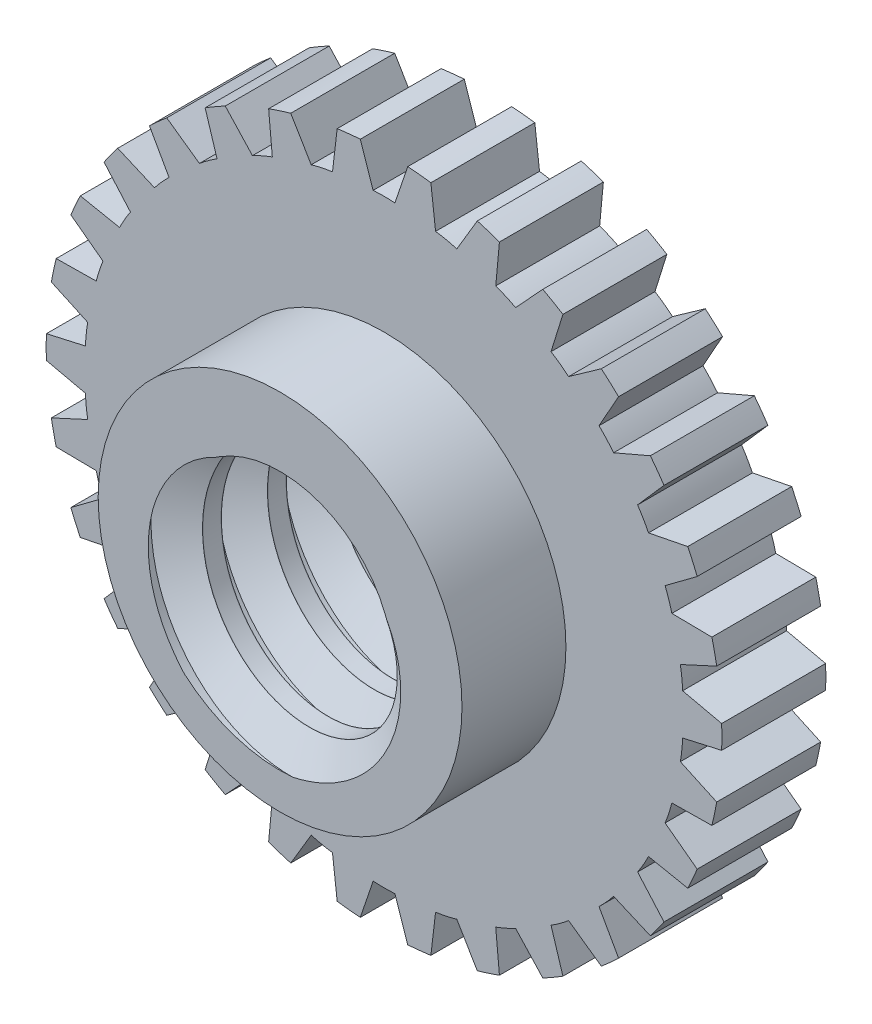
from build123d import *

# Parameters (mm, degrees)
IZIM1_R                     = 13
IZIM1_R_2                   = 4
Y_KSEKLIK_EKSTR_ZYON1_DEPTH = 4
IZIM2_R                     = 7
IZIM2_R_2                   = 4
Y_KSEKLIK_EKSTR_ZYON2_DEPTH = 4
KES_EKSTR_ZYON1_DEPTH       = 4
KES_S_P_R1_PITCH            = 2.5


with BuildPart() as part:
    # Çizim1 → Yükseklik-Ekstrüzyon1 (new body)
    with BuildSketch(Plane.XY):
        Circle(IZIM1_R)
        Circle(IZIM1_R_2, mode=Mode.SUBTRACT)
    extrude(amount=Y_KSEKLIK_EKSTR_ZYON1_DEPTH)

    # Çizim2 → Yükseklik-Ekstrüzyon2 (add)
    with BuildSketch(Plane.XY.offset(4)):
        Circle(IZIM2_R)
        Circle(IZIM2_R_2, mode=Mode.SUBTRACT)
    extrude(amount=Y_KSEKLIK_EKSTR_ZYON2_DEPTH)

    # Çizim3 → Kes-Ekstrüzyon1 (cut)
    with BuildSketch(Plane(origin=(0, 0, 0), x_dir=(-1, 0, 0), z_dir=(0, 0, -1))):
        with BuildLine():
            Line((2.802264463, 11.170557123), (3.589488331, 12.494621784))
            ThreePointArc((3.589488331, 12.494621784), (2.707778009, 12.739093953), (1.802859761, 12.87438141))
            Line((1.802859761, 12.87438141), (1.983478934, 11.34459536))
            ThreePointArc((1.983478934, 11.34459536), (2.395910473, 11.271872552), (2.802264463, 11.170557123))
        make_face()
        with BuildLine():
            Line((0.418538842, 11.509077192), (0.913271457, 12.967880908))
            ThreePointArc((0.913271457, 12.967880908), (0, 13.02369289), (-0.913271457, 12.967880908))
            Line((-0.913271457, 12.967880908), (-0.418538842, 11.509077192))
            ThreePointArc((-0.418538842, 11.509077192), (0, 11.52369289), (0.418538842, 11.509077192))
        make_face()
        with BuildLine():
            Line((5.06351768, 10.343830106), (6.10882734, 11.475287732))
            ThreePointArc((6.10882734, 11.475287732), (5.297213127, 11.897735482), (4.440197357, 12.218209666))
            Line((4.440197357, 12.218209666), (4.298809163, 10.684300274))
            ThreePointArc((4.298809163, 10.684300274), (4.687108162, 10.527417295), (5.06351768, 10.343830106))
        make_face()
        with BuildLine():
            Line((7.103470877, 9.065028079), (8.361181281, 9.954428542))
            ThreePointArc((8.361181281, 9.954428542), (7.655134611, 10.536388878), (6.883477022, 11.02804353))
            Line((6.883477022, 11.02804353), (6.426260804, 9.557049997))
            ThreePointArc((6.426260804, 9.557049997), (6.773456733, 9.322863386), (7.103470877, 9.065028079))
        make_face()
        with BuildLine():
            Line((8.832968311, 7.390040825), (10.248111478, 7.998513057))
            ThreePointArc((10.248111478, 7.998513057), (9.67848998, 8.714551521), (9.02591571, 9.355898973))
            Line((9.02591571, 9.355898973), (8.272854012, 8.012110775))
            ThreePointArc((8.272854012, 8.012110775), (8.563772742, 7.710855611), (8.832968311, 7.390040825))
        make_face()
        with BuildLine():
            Line((10.176422643, 5.392073326), (11.687150028, 5.693024171))
            ThreePointArc((11.687150028, 5.693024171), (11.278848894, 6.511846445), (10.773878571, 7.274856737))
            Line((10.773878571, 7.274856737), (9.757883801, 6.117003866))
            ThreePointArc((9.757883801, 6.117003866), (9.979810788, 5.761846445), (10.176422643, 5.392073326))
        make_face()
        with BuildLine():
            Line((11.075118475, 3.158446348), (12.615404041, 3.138722811))
            ThreePointArc((12.615404041, 3.138722811), (12.386267989, 4.024542433), (12.050971239, 4.875868352))
            Line((12.050971239, 4.875868352), (10.816447245, 3.954554535))
            ThreePointArc((10.816447245, 3.954554535), (10.959683215, 3.561016941), (11.075118475, 3.158446348))
        make_face()
        with BuildLine():
            Line((11.489778485, 0.78678011), (12.992304362, 0.447244202))
            ThreePointArc((12.992304362, 0.447244202), (12.952347738, 1.361346604), (12.801378638, 2.263781124))
            Line((12.801378638, 2.263781124), (11.402280041, 1.619272195))
            ThreePointArc((11.402280041, 1.619272195), (11.460564895, 1.204553909), (11.489778485, 0.78678011))
        make_face()
        with BuildLine():
            Line((11.402280041, -1.619272195), (12.801378638, -2.263781124))
            ThreePointArc((12.801378638, -2.263781124), (12.952347738, -1.361346604), (12.992304362, -0.447244202))
            Line((12.992304362, -0.447244202), (11.489778485, -0.78678011))
            ThreePointArc((11.489778485, -0.78678011), (11.460564895, -1.204553909), (11.402280041, -1.619272195))
        make_face()
        with BuildLine():
            Line((10.816447245, -3.954554535), (12.050971239, -4.875868352))
            ThreePointArc((12.050971239, -4.875868352), (12.386267989, -4.024542433), (12.615404041, -3.138722811))
            Line((12.615404041, -3.138722811), (11.075118475, -3.158446348))
            ThreePointArc((11.075118475, -3.158446348), (10.959683215, -3.561016941), (10.816447245, -3.954554535))
        make_face()
        with BuildLine():
            Line((9.757883801, -6.117003866), (10.773878571, -7.274856737))
            ThreePointArc((10.773878571, -7.274856737), (11.278848894, -6.511846445), (11.687150028, -5.693024171))
            Line((11.687150028, -5.693024171), (10.176422643, -5.392073326))
            ThreePointArc((10.176422643, -5.392073326), (9.979810788, -5.761846445), (9.757883801, -6.117003866))
        make_face()
        with BuildLine():
            Line((8.272854012, -8.012110775), (9.02591571, -9.355898973))
            ThreePointArc((9.02591571, -9.355898973), (9.67848998, -8.714551521), (10.248111478, -7.998513057))
            Line((10.248111478, -7.998513057), (8.832968311, -7.390040825))
            ThreePointArc((8.832968311, -7.390040825), (8.563772742, -7.710855611), (8.272854012, -8.012110775))
        make_face()
        with BuildLine():
            Line((6.426260804, -9.557049997), (6.883477022, -11.02804353))
            ThreePointArc((6.883477022, -11.02804353), (7.655134611, -10.536388878), (8.361181281, -9.954428542))
            Line((8.361181281, -9.954428542), (7.103470877, -9.065028079))
            ThreePointArc((7.103470877, -9.065028079), (6.773456733, -9.322863386), (6.426260804, -9.557049997))
        make_face()
        with BuildLine():
            Line((4.298809163, -10.684300274), (4.440197357, -12.218209666))
            ThreePointArc((4.440197357, -12.218209666), (5.297213127, -11.897735482), (6.10882734, -11.475287732))
            Line((6.10882734, -11.475287732), (5.06351768, -10.343830106))
            ThreePointArc((5.06351768, -10.343830106), (4.687108162, -10.527417295), (4.298809163, -10.684300274))
        make_face()
        with BuildLine():
            Line((1.983478934, -11.34459536), (1.802859761, -12.87438141))
            ThreePointArc((1.802859761, -12.87438141), (2.707778009, -12.739093953), (3.589488331, -12.494621784))
            Line((3.589488331, -12.494621784), (2.802264463, -11.170557123))
            ThreePointArc((2.802264463, -11.170557123), (2.395910473, -11.271872552), (1.983478934, -11.34459536))
        make_face()
        with BuildLine():
            Line((-0.418538842, -11.509077192), (-0.913271457, -12.967880908))
            ThreePointArc((-0.913271457, -12.967880908), (0, -13.02369289), (0.913271457, -12.967880908))
            Line((0.913271457, -12.967880908), (0.418538842, -11.509077192))
            ThreePointArc((0.418538842, -11.509077192), (0, -11.52369289), (-0.418538842, -11.509077192))
        make_face()
        with BuildLine():
            Line((-2.802264463, -11.170557123), (-3.589488331, -12.494621784))
            ThreePointArc((-3.589488331, -12.494621784), (-2.707778009, -12.739093953), (-1.802859761, -12.87438141))
            Line((-1.802859761, -12.87438141), (-1.983478934, -11.34459536))
            ThreePointArc((-1.983478934, -11.34459536), (-2.395910473, -11.271872552), (-2.802264463, -11.170557123))
        make_face()
        with BuildLine():
            Line((-5.06351768, -10.343830106), (-6.10882734, -11.475287732))
            ThreePointArc((-6.10882734, -11.475287732), (-5.297213127, -11.897735482), (-4.440197357, -12.218209666))
            Line((-4.440197357, -12.218209666), (-4.298809163, -10.684300274))
            ThreePointArc((-4.298809163, -10.684300274), (-4.687108162, -10.527417295), (-5.06351768, -10.343830106))
        make_face()
        with BuildLine():
            Line((-7.103470877, -9.065028079), (-8.361181281, -9.954428542))
            ThreePointArc((-8.361181281, -9.954428542), (-7.655134611, -10.536388878), (-6.883477022, -11.02804353))
            Line((-6.883477022, -11.02804353), (-6.426260804, -9.557049997))
            ThreePointArc((-6.426260804, -9.557049997), (-6.773456733, -9.322863386), (-7.103470877, -9.065028079))
        make_face()
        with BuildLine():
            Line((-8.832968311, -7.390040825), (-10.248111478, -7.998513057))
            ThreePointArc((-10.248111478, -7.998513057), (-9.67848998, -8.714551521), (-9.02591571, -9.355898973))
            Line((-9.02591571, -9.355898973), (-8.272854012, -8.012110775))
            ThreePointArc((-8.272854012, -8.012110775), (-8.563772742, -7.710855611), (-8.832968311, -7.390040825))
        make_face()
        with BuildLine():
            Line((-10.176422643, -5.392073326), (-11.687150028, -5.693024171))
            ThreePointArc((-11.687150028, -5.693024171), (-11.278848894, -6.511846445), (-10.773878571, -7.274856737))
            Line((-10.773878571, -7.274856737), (-9.757883801, -6.117003866))
            ThreePointArc((-9.757883801, -6.117003866), (-9.979810788, -5.761846445), (-10.176422643, -5.392073326))
        make_face()
        with BuildLine():
            Line((-11.075118475, -3.158446348), (-12.615404041, -3.138722811))
            ThreePointArc((-12.615404041, -3.138722811), (-12.386267989, -4.024542433), (-12.050971239, -4.875868352))
            Line((-12.050971239, -4.875868352), (-10.816447245, -3.954554535))
            ThreePointArc((-10.816447245, -3.954554535), (-10.959683215, -3.561016941), (-11.075118475, -3.158446348))
        make_face()
        with BuildLine():
            Line((-11.489778485, -0.78678011), (-12.992304362, -0.447244202))
            ThreePointArc((-12.992304362, -0.447244202), (-12.952347738, -1.361346604), (-12.801378638, -2.263781124))
            Line((-12.801378638, -2.263781124), (-11.402280041, -1.619272195))
            ThreePointArc((-11.402280041, -1.619272195), (-11.460564895, -1.204553909), (-11.489778485, -0.78678011))
        make_face()
        with BuildLine():
            Line((-11.402280041, 1.619272195), (-12.801378638, 2.263781124))
            ThreePointArc((-12.801378638, 2.263781124), (-12.952347738, 1.361346604), (-12.992304362, 0.447244202))
            Line((-12.992304362, 0.447244202), (-11.489778485, 0.78678011))
            ThreePointArc((-11.489778485, 0.78678011), (-11.460564895, 1.204553909), (-11.402280041, 1.619272195))
        make_face()
        with BuildLine():
            Line((-10.816447245, 3.954554535), (-12.050971239, 4.875868352))
            ThreePointArc((-12.050971239, 4.875868352), (-12.386267989, 4.024542433), (-12.615404041, 3.138722811))
            Line((-12.615404041, 3.138722811), (-11.075118475, 3.158446348))
            ThreePointArc((-11.075118475, 3.158446348), (-10.959683215, 3.561016941), (-10.816447245, 3.954554535))
        make_face()
        with BuildLine():
            Line((-9.757883801, 6.117003866), (-10.773878571, 7.274856737))
            ThreePointArc((-10.773878571, 7.274856737), (-11.278848894, 6.511846445), (-11.687150028, 5.693024171))
            Line((-11.687150028, 5.693024171), (-10.176422643, 5.392073326))
            ThreePointArc((-10.176422643, 5.392073326), (-9.979810788, 5.761846445), (-9.757883801, 6.117003866))
        make_face()
        with BuildLine():
            Line((-8.272854012, 8.012110775), (-9.02591571, 9.355898973))
            ThreePointArc((-9.02591571, 9.355898973), (-9.67848998, 8.714551521), (-10.248111478, 7.998513057))
            Line((-10.248111478, 7.998513057), (-8.832968311, 7.390040825))
            ThreePointArc((-8.832968311, 7.390040825), (-8.563772742, 7.710855611), (-8.272854012, 8.012110775))
        make_face()
        with BuildLine():
            Line((-6.426260804, 9.557049997), (-6.883477022, 11.02804353))
            ThreePointArc((-6.883477022, 11.02804353), (-7.655134611, 10.536388878), (-8.361181281, 9.954428542))
            Line((-8.361181281, 9.954428542), (-7.103470877, 9.065028079))
            ThreePointArc((-7.103470877, 9.065028079), (-6.773456733, 9.322863386), (-6.426260804, 9.557049997))
        make_face()
        with BuildLine():
            Line((-4.298809163, 10.684300274), (-4.440197357, 12.218209666))
            ThreePointArc((-4.440197357, 12.218209666), (-5.297213127, 11.897735482), (-6.10882734, 11.475287732))
            Line((-6.10882734, 11.475287732), (-5.06351768, 10.343830106))
            ThreePointArc((-5.06351768, 10.343830106), (-4.687108162, 10.527417295), (-4.298809163, 10.684300274))
        make_face()
        with BuildLine():
            Line((-1.983478934, 11.34459536), (-1.802859761, 12.87438141))
            ThreePointArc((-1.802859761, 12.87438141), (-2.707778009, 12.739093953), (-3.589488331, 12.494621784))
            Line((-3.589488331, 12.494621784), (-2.802264463, 11.170557123))
            ThreePointArc((-2.802264463, 11.170557123), (-2.395910473, 11.271872552), (-1.983478934, 11.34459536))
        make_face()
    extrude(amount=-KES_EKSTR_ZYON1_DEPTH, mode=Mode.SUBTRACT)

    # Kes-Süpür1: arcs per turn and ends read off the stored shape
    # Kes-Süpür1: the profile of Çizim5 screwed along a right-hand helix through 5 turns, 10 arcs to a turn; built about Z, then put on its axis
    kes_s_p_r1_z = Axis((0, 0, 0), (0, 0, 1))
    kes_s_p_r1_corners = [(3.811695678, 0, -0.9), (4.354918045, 0, -0.9), (4.354918045, 0, -1.612538661), (5.614918045, 0, -2.34), (5.614918045, 0, -2.66), (4.354918045, 0, -3.387461339), (4.354918045, 0, -4.1), (3.811695678, 0, -4.1)]
    with BuildLine(mode=Mode.PRIVATE) as kes_s_p_r1_profile:
        Line(kes_s_p_r1_corners[0], kes_s_p_r1_corners[1])
        Line(kes_s_p_r1_corners[1], kes_s_p_r1_corners[2])
        Line(kes_s_p_r1_corners[2], kes_s_p_r1_corners[3])
        Line(kes_s_p_r1_corners[3], kes_s_p_r1_corners[4])
        Line(kes_s_p_r1_corners[4], kes_s_p_r1_corners[5])
        Line(kes_s_p_r1_corners[5], kes_s_p_r1_corners[6])
        Line(kes_s_p_r1_corners[6], kes_s_p_r1_corners[7])
        Line(kes_s_p_r1_corners[7], kes_s_p_r1_corners[0])
    kes_s_p_r1_cap = Face(kes_s_p_r1_profile.wire())
    kes_s_p_r1_turn_angles = [0, 18, 36, 54, 72, 90, 108, 126, 144, 162, 180, 198, 216, 234, 252, 270, 288, 306, 324, 342, 360]
    kes_s_p_r1_turn_weights = [1, 0.9510565162951535, 1, 0.9510565162951535, 1, 0.9510565162951535, 1, 0.9510565162951535, 1, 0.9510565162951535, 1, 0.9510565162951535, 1, 0.9510565162951535, 1, 0.9510565162951535, 1, 0.9510565162951535, 1, 0.9510565162951535, 1]
    kes_s_p_r1_turn_rails = [Edge.make_bspline([Vector(p[0], p[1], 0).rotate(kes_s_p_r1_z, kes_s_p_r1_turn_angles[k]) / kes_s_p_r1_turn_weights[k] + Vector(0, 0, p[2] + KES_S_P_R1_PITCH * kes_s_p_r1_turn_angles[k] / 360) for k in range(21)], [0, 0, 0, 1, 1, 2, 2, 3, 3, 4, 4, 5, 5, 6, 6, 7, 7, 8, 8, 9, 9, 10, 10, 10], 2, kes_s_p_r1_turn_weights) for p in kes_s_p_r1_corners]
    kes_s_p_r1_turn_sides = [Face.make_surface_from_curves(kes_s_p_r1_turn_rails[p[0]], kes_s_p_r1_turn_rails[p[1]]) for p in [(0, 1), (1, 2), (2, 3), (3, 4), (4, 5), (5, 6), (6, 7), (7, 0)]]
    kes_s_p_r1_turn = Solid(Shell([*kes_s_p_r1_turn_sides, kes_s_p_r1_cap, kes_s_p_r1_cap.rotate(kes_s_p_r1_z, 360).moved(Location((0, 0, KES_S_P_R1_PITCH * 360 / 360)))]))
    kes_s_p_r1_each = [*[kes_s_p_r1_turn.moved(Location((0, 0, KES_S_P_R1_PITCH * i))) for i in range(5)]]
    add(Plane(origin=(0, 0, 0), x_dir=(-1, 0, 0), z_dir=(0, 0, 1)) * Compound([kes_s_p_r1_each[i] for i in range(0, 5, 2)]), mode=Mode.SUBTRACT)
    add(Plane(origin=(0, 0, 0), x_dir=(-1, 0, 0), z_dir=(0, 0, 1)) * Compound([kes_s_p_r1_each[i] for i in range(1, 5, 2)]), mode=Mode.SUBTRACT)


solid = part.part
